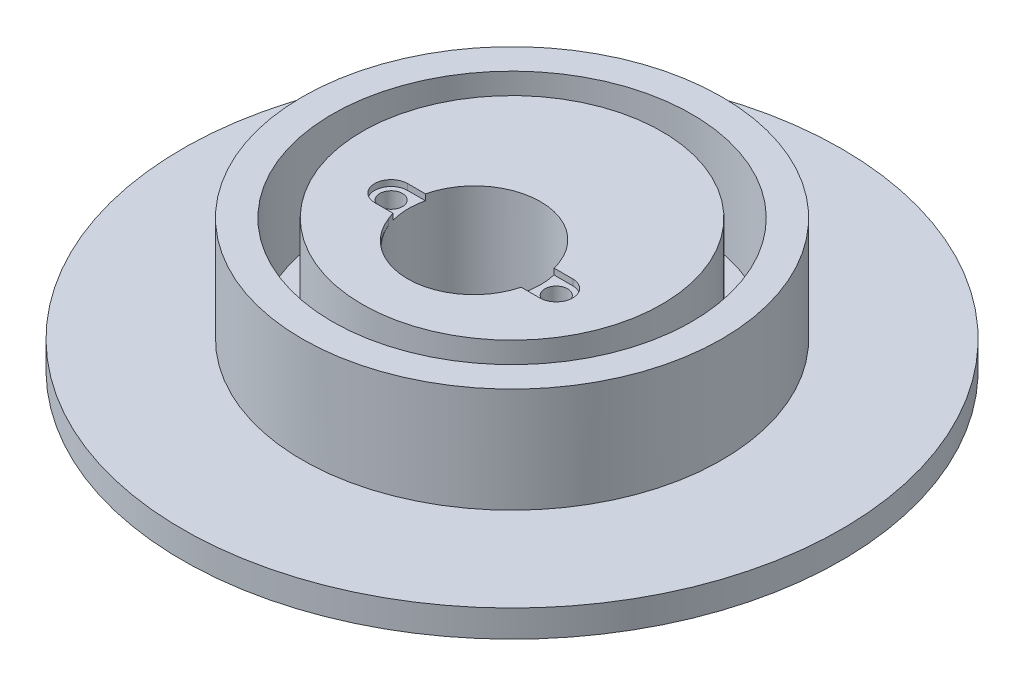
from build123d import *

# Parameters (mm, degrees)
SKETCH2_R           = 44.45
BOSS_EXTRUDE1_DEPTH = 6.35
SKETCH2_3_R         = 44.45
SKETCH2_3_R_2       = 38.1
BOSS_EXTRUDE2_DEPTH = 27.94
SKETCH3_R           = 31.75
SKETCH3_R_2         = 14
BOSS_EXTRUDE4_DEPTH = 21.59
CUT_EXTRUDE1_START  = -1.27
CUT_EXTRUDE1_DEPTH  = 1.27
SKETCH4_3_R         = 2.413
CUT_EXTRUDE2_DEPTH  = 8.89
SKETCH5_R           = 69.85
BOSS_EXTRUDE5_DEPTH = 5.715


with BuildPart() as part:
    # Sketch2 → Boss-Extrude1 (new body)
    with BuildSketch(Plane(origin=(0, 0, 0), x_dir=(1, 0, 0), z_dir=(0, 1, 0))):
        Circle(SKETCH2_R)
    extrude(amount=BOSS_EXTRUDE1_DEPTH)

    # Sketch2<3> → Boss-Extrude2 (add)
    with BuildSketch(Plane(origin=(0, 0, 0), x_dir=(1, 0, 0), z_dir=(0, 1, 0))):
        Circle(SKETCH2_3_R)
        Circle(SKETCH2_3_R_2, mode=Mode.SUBTRACT)
    extrude(amount=BOSS_EXTRUDE2_DEPTH)

    # Sketch3 → Boss-Extrude4 (add)
    with BuildSketch(Plane(origin=(0, 6.35, 0), x_dir=(1, 0, 0), z_dir=(0, 1, 0))):
        Circle(SKETCH3_R)
        with Locations((0.028088934, -8.000057344)):
            Circle(SKETCH3_R_2, mode=Mode.SUBTRACT)
    extrude(amount=BOSS_EXTRUDE4_DEPTH)

    # Sketch4 → Cut-Extrude1 (cut)
    with BuildSketch(Plane(origin=(0, 27.94, 0), x_dir=(1, 0, 0), z_dir=(0, 1, 0)).offset(CUT_EXTRUDE1_START)):
        with BuildLine():
            ThreePointArc((-13.456816363, -11.762679984), (-13.9692833, -8.271296235), (-13.592461269, -4.762679984))
            Line((-13.592461269, -4.762679984), (-17.368671482, -4.762679984))
            ThreePointArc((-17.368671482, -4.762679984), (-20.868671482, -8.262679984), (-17.368671482, -11.762679984))
            Line((-17.368671482, -11.762679984), (-13.456816363, -11.762679984))
        make_face()
        with BuildLine():
            ThreePointArc((13.68677023, -4.762679984), (13.426533126, -3.876618603), (13.108446408, -3.009641695))
            ThreePointArc((13.108446408, -3.009641695), (5.150076024, -21.029456726), (-12.949028956, -13.253095633))
            ThreePointArc((-12.949028956, -13.253095633), (0.913480012, -22.240814303), (13.68677023, -11.762679984))
            Line((13.68677023, -11.762679984), (17.631328518, -11.762679984))
            ThreePointArc((17.631328518, -11.762679984), (21.131328518, -8.262679984), (17.631328518, -4.762679984))
            Line((17.631328518, -4.762679984), (13.68677023, -4.762679984))
        make_face()
    extrude(amount=CUT_EXTRUDE1_DEPTH, mode=Mode.SUBTRACT)

    # Sketch4<3> → Cut-Extrude2 (cut)
    with BuildSketch(Plane(origin=(0, 27.94, 0), x_dir=(1, 0, 0), z_dir=(0, 1, 0))):
        with Locations((-17.368671482, -8.262679984)):
            Circle(SKETCH4_3_R)
        with Locations((17.631328518, -8.262679984)):
            Circle(SKETCH4_3_R)
    extrude(amount=-CUT_EXTRUDE2_DEPTH, mode=Mode.SUBTRACT)

    # Sketch5 → Boss-Extrude5 (add)
    with BuildSketch(Plane.XZ):
        Circle(SKETCH5_R)
    extrude(amount=-BOSS_EXTRUDE5_DEPTH)


solid = part.part
